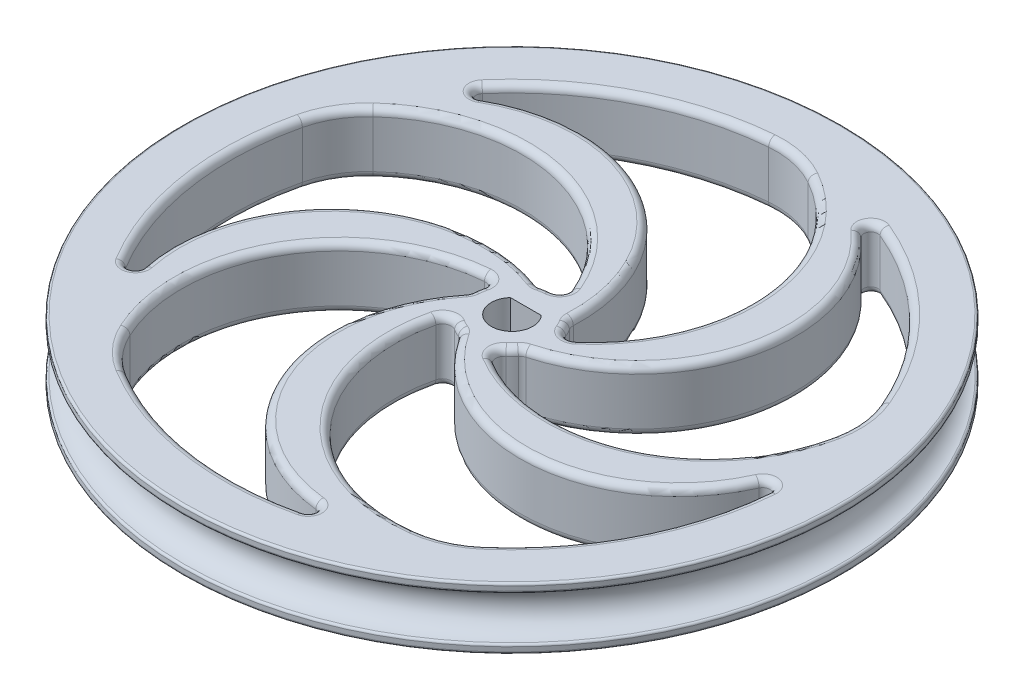
from build123d import *

# Parameters (mm, degrees)
LIP_BEVEL_R                   = 0.15875
SPOKES_DEPTH                  = 34.968049371
HUB_FILLET_R                  = 0.635
SPOKES_TO_RIM_OBTUSE_FILLET_R = 6.35
SPOKES_TO_RIM_ACUTE_FILLET_R  = 0.508
HUB_FACE_FILLET_R             = 0.508
AXLE_CUT_DEPTH                = 34.968049384


with BuildPart() as part:
    # Sketch1 → rim revolve (revolve)
    with BuildSketch(Plane.XY):
        with BuildLine():
            Line((23.8125, 4.445), (23.8125, 3.81))
            ThreePointArc((23.8125, 3.81), (22.225, 2.2225), (23.8125, 0.635))
            Line((23.8125, 0.635), (23.8125, 0))
            Line((23.8125, 0), (0, 0))
            Line((0, 0), (0, 4.445))
            Line((0, 4.445), (23.8125, 4.445))
        make_face()
    revolve(axis=Axis((0, 0, 0), (0, 1, 0)))

    # lip bevel
    lip_bevel_edges = [part.edges().sort_by_distance(p)[0] for p in [
        (-23.8125, 0, 0),
        (-23.8125, 0.635, 0),
        (-23.8125, 3.81, 0),
        (-23.8125, 4.445, 0),
    ]]
    fillet(lip_bevel_edges, radius=LIP_BEVEL_R)

    # Sketch3 → spokes (cut, through all)
    with BuildSketch(Plane(origin=(0, 4.445, 0), x_dir=(1, 0, 0), z_dir=(0, 1, 0))):
        with BuildLine():
            ThreePointArc((11.943796327, -16.439225326), (18.563243699, -8.264888587), (20.208684914, 2.124018374))
            ThreePointArc((20.208684914, 2.124018374), (11.454554701, -7.926654067), (-0.877115114, -2.868914268))
            ThreePointArc((-0.877115114, -2.868914268), (-1.668625791, -2.493128149), (-2.31780188, -1.904676992))
            ThreePointArc((-2.31780188, -1.904676992), (0.372519159, -13.5290397), (11.943796327, -16.439225326))
        make_face()
        with BuildLine():
            ThreePointArc((1.095215294, -2.792938141), (12.981996117, -3.826416412), (19.325468411, 6.279225326))
            ThreePointArc((19.325468411, 6.279225326), (13.596733921, 15.100702854), (4.224765557, 19.875959247))
            ThreePointArc((4.224765557, 19.875959247), (11.078348069, 8.444458074), (2.457456133, -1.720729309))
            ThreePointArc((2.457456133, -1.720729309), (1.855472046, -2.357376399), (1.095215294, -2.792938141))
        make_face()
        with BuildLine():
            ThreePointArc((-11.943796327, -16.439225326), (-2.124018374, -20.208684914), (8.264888587, -18.563243699))
            ThreePointArc((8.264888587, -18.563243699), (-3.999043938, -13.343399705), (-2.999543085, -0.052357219))
            ThreePointArc((-2.999543085, -0.052357219), (-2.886739499, 0.816538465), (-2.527695635, 1.615783022))
            ThreePointArc((-2.527695635, 1.615783022), (-12.751766616, -4.534989958), (-11.943796327, -16.439225326))
        make_face()
        with BuildLine():
            ThreePointArc((2.994682157, 0.178546292), (7.650795684, 11.164184303), (0, 20.32))
            ThreePointArc((0, 20.32), (-10.16, 17.597636205), (-17.597636205, 10.16))
            ThreePointArc((-17.597636205, 10.16), (-4.607759055, 13.145616174), (2.39590653, 1.805445069))
            ThreePointArc((2.39590653, 1.805445069), (2.815370581, 1.03618941), (2.994682157, 0.178546292))
        make_face()
        with BuildLine():
            ThreePointArc((-19.325468411, 6.279225326), (-19.875959247, -4.224765557), (-15.100702854, -13.596733921))
            ThreePointArc((-15.100702854, -13.596733921), (-13.926099777, -0.320020476), (-0.976704463, 2.836555727))
            ThreePointArc((-0.976704463, 2.836555727), (-0.115477336, 2.997776674), (0.755600065, 2.903285818))
            ThreePointArc((0.755600065, 2.903285818), (-8.253544344, 10.726261768), (-19.325468411, 6.279225326))
        make_face()
    extrude(amount=-SPOKES_DEPTH, mode=Mode.SUBTRACT)

    # hub fillet
    hub_fillet_edges = [part.edges().sort_by_distance(p)[0] for p in [
        (2.994682157, 2.2225, -0.178546292),
        (0.755600065, 2.2225, -2.903285818),
        (-0.976704463, 2.2225, -2.836555727),
        (-2.527695635, 2.2225, -1.615783022),
        (-2.999543085, 2.2225, 0.052357219),
        (-0.877115114, 2.2225, 2.868914268),
        (-2.31780188, 2.2225, 1.904676992),
        (1.095215294, 2.2225, 2.792938141),
        (2.457456133, 2.2225, 1.720729309),
        (2.39590653, 2.2225, -1.805445069),
    ]]
    fillet(hub_fillet_edges, radius=HUB_FILLET_R)

    # spokes to rim obtuse fillet
    spokes_to_rim_obtuse_fillet_edges = [part.edges().sort_by_distance(p)[0] for p in [
        (0, 2.2225, -20.32),
        (19.325468411, 2.2225, -6.279225326),
        (11.943796327, 2.2225, 16.439225326),
        (-11.943796327, 2.2225, 16.439225326),
        (-19.325468411, 2.2225, -6.279225326),
    ]]
    fillet(spokes_to_rim_obtuse_fillet_edges, radius=SPOKES_TO_RIM_OBTUSE_FILLET_R)

    # spokes to rim acute fillet
    spokes_to_rim_acute_fillet_edges = [part.edges().sort_by_distance(p)[0] for p in [
        (-15.100702854, 2.2225, 13.596733921),
        (8.264888587, 2.2225, 18.563243699),
        (20.208684914, 2.2225, -2.124018374),
        (4.224765557, 2.2225, -19.875959247),
        (-17.597636205, 2.2225, -10.16),
    ]]
    fillet(spokes_to_rim_acute_fillet_edges, radius=SPOKES_TO_RIM_ACUTE_FILLET_R)

    # hub face fillet
    hub_face_fillet_edges = [part.edges().sort_by_distance(p)[0] for p in [
        (-16.744714107, 4.445, 10.758173584),
        (-12.700118087, 4.445, -0.905031214),
        (-0.982438695, 4.445, -2.874179937),
        (-0.472592407, 4.445, -2.962542222),
        (0.350018618, 4.445, -3.292517021),
        (-7.719603677, 4.445, -10.623396182),
        (-19.08661236, 4.445, -6.386354103),
        (-20.067259756, 4.445, 3.194915631),
        (19.870254053, 4.445, 1.138750748),
        (9.742647363, 4.445, 8.197127746),
        (-0.894590979, 4.445, 2.90272339),
        (-1.359003339, 4.445, 2.674529851),
        (-2.218463958, 4.445, 2.457966443),
        (0.001014959, 4.445, 13.131977244),
        (11.687589007, 4.445, 16.385498263),
        (18.112678463, 4.445, 9.210498297),
        (-15.406032316, 4.445, -12.600710999),
        (-3.063816486, 4.445, -12.35820009),
        (2.429917305, 4.445, -1.822525168),
        (2.671506, 4.445, -1.364937981),
        (3.239531469, 4.445, -0.684556227),
        (7.717961438, 4.445, -10.624589338),
        (0.175696101, 4.445, -20.125939009),
        (-9.239669625, 4.445, -18.097814929),
        (7.223262504, 4.445, -18.545841264),
        (10.806575363, 4.445, -6.732756482),
        (2.484210179, 4.445, 1.747797437),
        (2.123673916, 4.445, 2.118964157),
        (1.652121938, 4.445, 2.869438006),
        (12.489566169, 4.445, 4.057038855),
        (19.195198522, 4.445, -6.05216026),
        (14.356829883, 4.445, -14.379980379),
        (5.057229866, 4.445, 19.249627931),
        (-4.785288153, 4.445, 11.798860039),
        (-3.03709781, 4.445, 0.046184277),
        (-2.96358417, 4.445, -0.466013805),
        (-3.023208067, 4.445, -1.350331201),
        (-12.48893889, 4.445, 4.058969421),
        (-11.971871269, 4.445, 16.178955109),
        (-3.162578965, 4.445, 20.072381381),
        (-0.982438695, 0, -2.874179937),
        (-12.700118087, 0, -0.905031214),
        (-16.744714107, 0, 10.758173584),
        (-20.067259756, 0, 3.194915631),
        (-19.08661236, 0, -6.386354103),
        (-7.719603677, 0, -10.623396182),
        (0.350018618, 0, -3.292517021),
        (-0.472592407, 0, -2.962542222),
        (-0.894590979, 0, 2.90272339),
        (9.742647363, 0, 8.197127746),
        (19.870254053, 0, 1.138750748),
        (18.112678463, 0, 9.210498297),
        (11.687589007, 0, 16.385498263),
        (0.001014959, 0, 13.131977244),
        (-2.218463958, 0, 2.457966443),
        (-1.359003339, 0, 2.674529851),
        (3.239531469, 0, -0.684556227),
        (2.671506, 0, -1.364937981),
        (2.429917305, 0, -1.822525168),
        (-3.063816486, 0, -12.35820009),
        (-15.406032316, 0, -12.600710999),
        (-9.239669625, 0, -18.097814929),
        (0.175696101, 0, -20.125939009),
        (7.717961438, 0, -10.624589338),
        (2.484210179, 0, 1.747797437),
        (10.806575363, 0, -6.732756482),
        (7.223262504, 0, -18.545841264),
        (14.356829883, 0, -14.379980379),
        (19.195198522, 0, -6.05216026),
        (12.489566169, 0, 4.057038855),
        (1.652121938, 0, 2.869438006),
        (2.123673916, 0, 2.118964157),
        (-3.03709781, 0, 0.046184277),
        (-4.785288153, 0, 11.798860039),
        (5.057229866, 0, 19.249627931),
        (-3.162578965, 0, 20.072381381),
        (-11.971871269, 0, 16.178955109),
        (-12.48893889, 0, 4.058969421),
        (-3.023208067, 0, -1.350331201),
        (-2.96358417, 0, -0.466013805),
    ]]
    fillet(hub_face_fillet_edges, radius=HUB_FACE_FILLET_R)

    # Sketch2 → axle cut (cut, through all)
    with BuildSketch(Plane(origin=(0, 4.445, 0), x_dir=(1, 0, 0), z_dir=(0, 1, 0))):
        with BuildLine():
            Line((1.118033989, 1), (-1.118033989, 1))
            ThreePointArc((-1.118033989, 1), (-0.535233135, -1.401258538), (1.5, 0))
            ThreePointArc((1.5, 0), (1.401258538, 0.535233135), (1.118033989, 1))
        make_face()
    extrude(amount=-AXLE_CUT_DEPTH, mode=Mode.SUBTRACT)


solid = part.part
